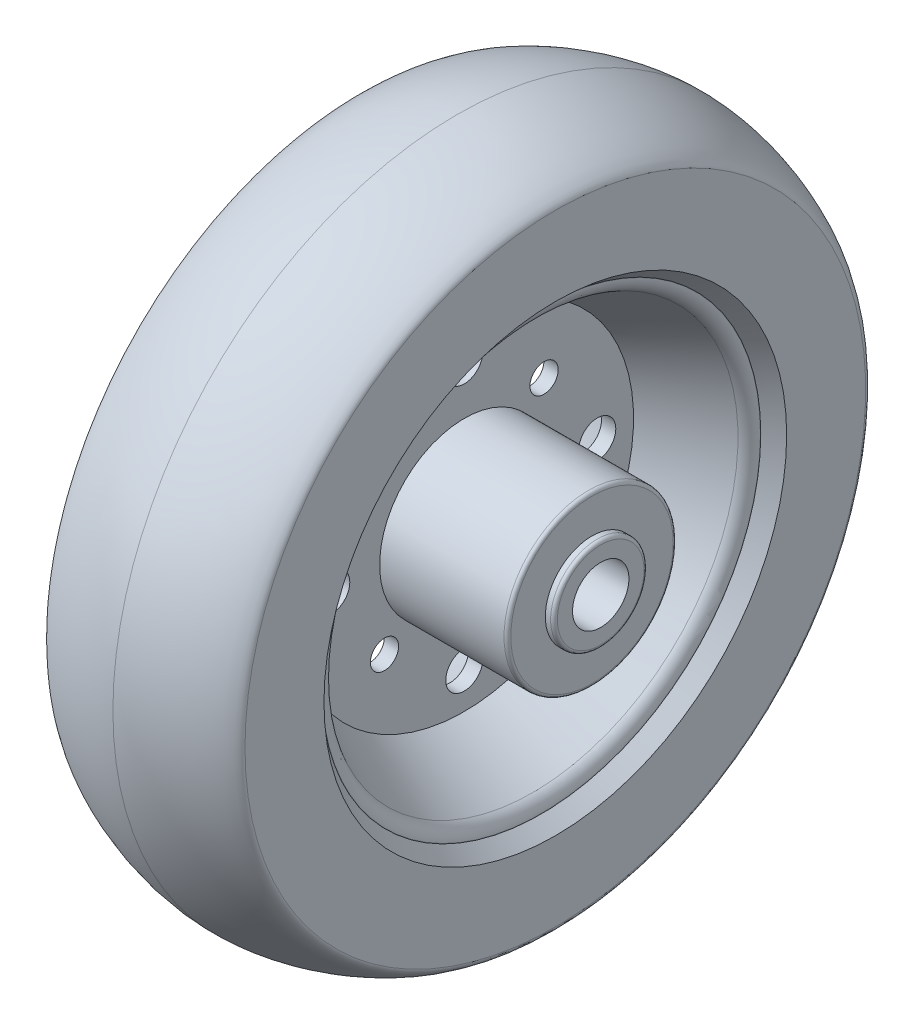
from build123d import *

# Parameters (mm, degrees)
SKETCH8_R           = 19.05
BOSS_EXTRUDE1_DEPTH = 28.7528
SKETCH9_R           = 10.5156
BOSS_EXTRUDE2_DEPTH = 1.9558
SKETCH11_R          = 4.1656
SKETCH11_R_2        = 3.175
CUT_EXTRUDE6_DEPTH  = 114.781456947
BOSS_EXTRUDE3_START = 27.6606
SKETCH12_R          = 19.05
BOSS_EXTRUDE3_DEPTH = 27.6606
SKETCH13_R          = 10.30605
BOSS_EXTRUDE4_DEPTH = 2.2352
FILLET4_R           = 0.762
SKETCH14_R          = 6.35
CUT_EXTRUDE7_DEPTH  = 127.797067249


with BuildPart() as part:
    # Sketch5 → Revolve1 (revolve)
    with BuildSketch(Plane.XY):
        with BuildLine():
            Line((-22.10435, 0), (-22.10435, 69.85))
            add(Edge.make_bspline(
                [(-22.10435, 69.85), (-22.10435, 72.067965362), (-10.536247667, 77.47), (0, 77.47)],
                knots=[0, 0, 0, 0, 1, 1, 1, 1], degree=3))
            add(Edge.make_bspline(
                [(22.10435, 69.85), (22.10435, 72.067965362), (10.536247667, 77.47), (0, 77.47)],
                knots=[0, 0, 0, 0, 1, 1, 1, 1], degree=3))
            Line((22.10435, 69.85), (22.10435, 0))
            Line((22.10435, 0), (-22.10435, 0))
        make_face()
    revolve(axis=Axis((-22.10435, 0, 0), (1, 0, 0)))

    # Sketch7 → Cut-Revolve2 (revolve, cut)
    with BuildSketch(Plane(origin=(0, 0, 0), x_dir=(1, 0, 0), z_dir=(0, 1, 0))):
        with BuildLine():
            Line((1.6129, 0), (1.6129, 38.1))
            Line((1.6129, 38.1), (17.026355511, 46.192414899))
            ThreePointArc((17.026355511, 46.192414899), (18.416639634, 47.501424516), (18.92935, 49.340860354))
            Line((18.92935, 49.340860354), (18.92935, 49.412815204))
            Line((18.92935, 49.412815204), (22.10435, 52.07))
            Line((22.10435, 52.07), (22.10435, 0))
            Line((22.10435, 0), (1.6129, 0))
        make_face()
    cut_revolve2 = revolve(axis=Axis((-1000, 0, 0), (1, 0, 0)), mode=Mode.SUBTRACT)

    # Mirror1: Cut-Revolve2 across plane
    add(cut_revolve2.mirror(Plane(origin=(0, 0, 0), x_dir=(0, 0, 1), z_dir=(1, 0, 0))), mode=Mode.SUBTRACT)

    # Sketch8 → Boss-Extrude1 (add)
    with BuildSketch(Plane(origin=(1.6129, 0, 0), x_dir=(0, 0, -1), z_dir=(1, 0, 0))):
        Circle(SKETCH8_R)
    extrude(amount=BOSS_EXTRUDE1_DEPTH)

    # Sketch9 → Boss-Extrude2 (add)
    with BuildSketch(Plane(origin=(30.3657, 0, 0), x_dir=(0, 0, -1), z_dir=(1, 0, 0))):
        Circle(SKETCH9_R)
    extrude(amount=BOSS_EXTRUDE2_DEPTH)

    # Sketch11 → Cut-Extrude6 (cut, through all)
    with BuildSketch(Plane(origin=(1.6129, 0, 0), x_dir=(0, 0, -1), z_dir=(1, 0, 0))):
        with Locations((0, 29.9339)):
            Circle(SKETCH11_R)
        with Locations((17.960512242, 17.960512242)):
            Circle(SKETCH11_R_2)
        with Locations((29.9339, 0)):
            Circle(SKETCH11_R)
        with Locations((0, -29.9339)):
            Circle(SKETCH11_R)
        with Locations((-29.9339, 0)):
            Circle(SKETCH11_R)
        with Locations((17.960512242, -17.960512242)):
            Circle(SKETCH11_R_2)
        with Locations((-17.960512242, -17.960512242)):
            Circle(SKETCH11_R_2)
    extrude(amount=-CUT_EXTRUDE6_DEPTH, mode=Mode.SUBTRACT)

    # Sketch12 → Boss-Extrude3 (add)
    with BuildSketch(Plane.ZY.offset(1.6129).offset(BOSS_EXTRUDE3_START)):
        Circle(SKETCH12_R)
    extrude(amount=-BOSS_EXTRUDE3_DEPTH)

    # Sketch13 → Boss-Extrude4 (add)
    with BuildSketch(Plane.ZY.offset(29.2735)):
        Circle(SKETCH13_R)
    extrude(amount=BOSS_EXTRUDE4_DEPTH)

    # Fillet4
    fillet4_edges = [part.edges().sort_by_distance(p)[0] for p in [
        (32.3215, 0, 10.5156),
        (30.3657, 0, 19.05),
        (-31.5087, 0, -10.30605),
        (-29.2735, 0, -19.05),
    ]]
    fillet(fillet4_edges, radius=FILLET4_R)

    # Sketch14 → Cut-Extrude7 (cut, through all)
    with BuildSketch(Plane(origin=(32.3215, 0, 0), x_dir=(0, 0, -1), z_dir=(1, 0, 0))):
        Circle(SKETCH14_R)
    extrude(amount=-CUT_EXTRUDE7_DEPTH, mode=Mode.SUBTRACT)


solid = part.part
